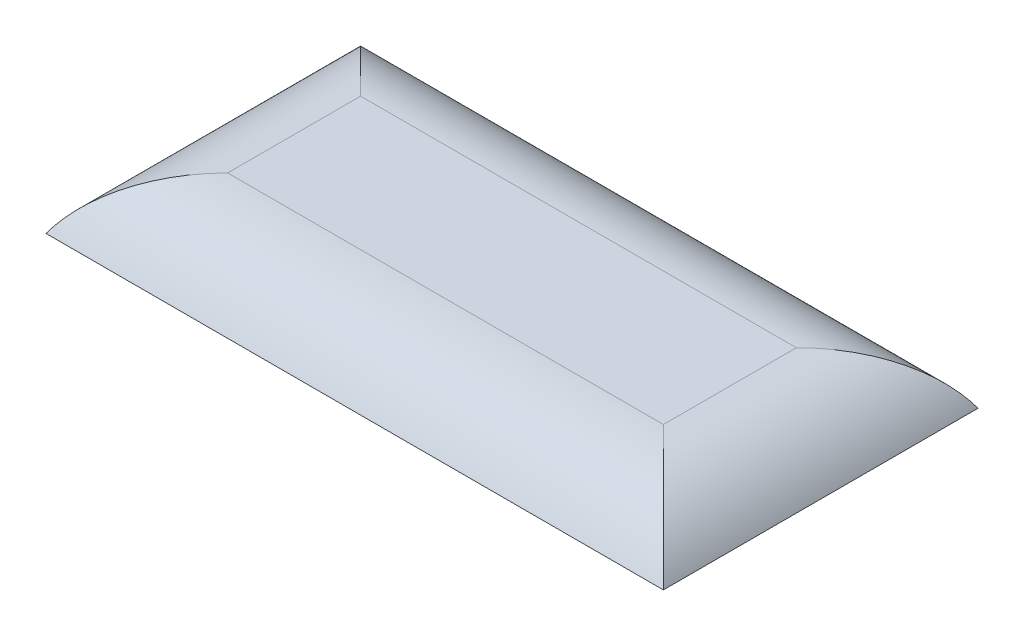
from build123d import *

# Parameters (mm, degrees)
SKETCH1_W           = 58.87
SKETCH1_H           = 30
BOSS_EXTRUDE1_DEPTH = 5
FILLET1_R           = 10


with BuildPart() as part:
    # Sketch1 → Boss-Extrude1 (new body)
    with BuildSketch(Plane(origin=(0, 0, 0), x_dir=(1, 0, 0), z_dir=(0, 1, 0))):
        with Locations((-16.179054094, -13.327647659)):
            Rectangle(SKETCH1_W, SKETCH1_H)
    extrude(amount=BOSS_EXTRUDE1_DEPTH)

    # Fillet1
    # the kernel refuses this fillet: 10 mm, written as the material it takes off along each edge
    with BuildSketch(Plane(origin=(-67.264689188, 5, -1.672352341), x_dir=(0, -1, 0), z_dir=(1, 0, 0)), Plane(origin=(34.906581001, 5, 28.327647659), x_dir=(0, -1, 0), z_dir=(-1, 0, 0))) as fillet1_piece_1:
        with BuildLine():
            CenterArc((10, -8.660254038), FILLET1_R, 120, 60)
            Line((0, -8.660254038), (-0.2, -8.660254038))
            Line((-0.2, -8.660254038), (-0.2, 0))
            Line((-0.2, 0), (0, 0.2))
            ThreePointArc((0, 0.2), (2.5, 0.2), (4.9, 0.173205081))
            Line((4.9, 0.173205081), (5, 0))
        make_face()
    extrude(amount=102.171270189, mode=Mode.SUBTRACT)
    with BuildSketch(Plane(origin=(13.255945906, 5, -23.322987436), x_dir=(0, -1, 0), z_dir=(0, 0, 1)), Plane(origin=(-45.614054094, 5, 49.978282753), x_dir=(0, -1, 0), z_dir=(0, 0, -1))) as fillet1_piece_2:
        with BuildLine():
            CenterArc((10, -8.660254038), FILLET1_R, 120, 60)
            Line((0, -8.660254038), (-0.2, -8.660254038))
            Line((-0.2, -8.660254038), (-0.2, 0))
            Line((-0.2, 0), (0, 0.2))
            ThreePointArc((0, 0.2), (2.5, 0.2), (4.9, 0.173205081))
            Line((4.9, 0.173205081), (5, 0))
        make_face()
    extrude(amount=73.301270189, mode=Mode.SUBTRACT)


solid = part.part
